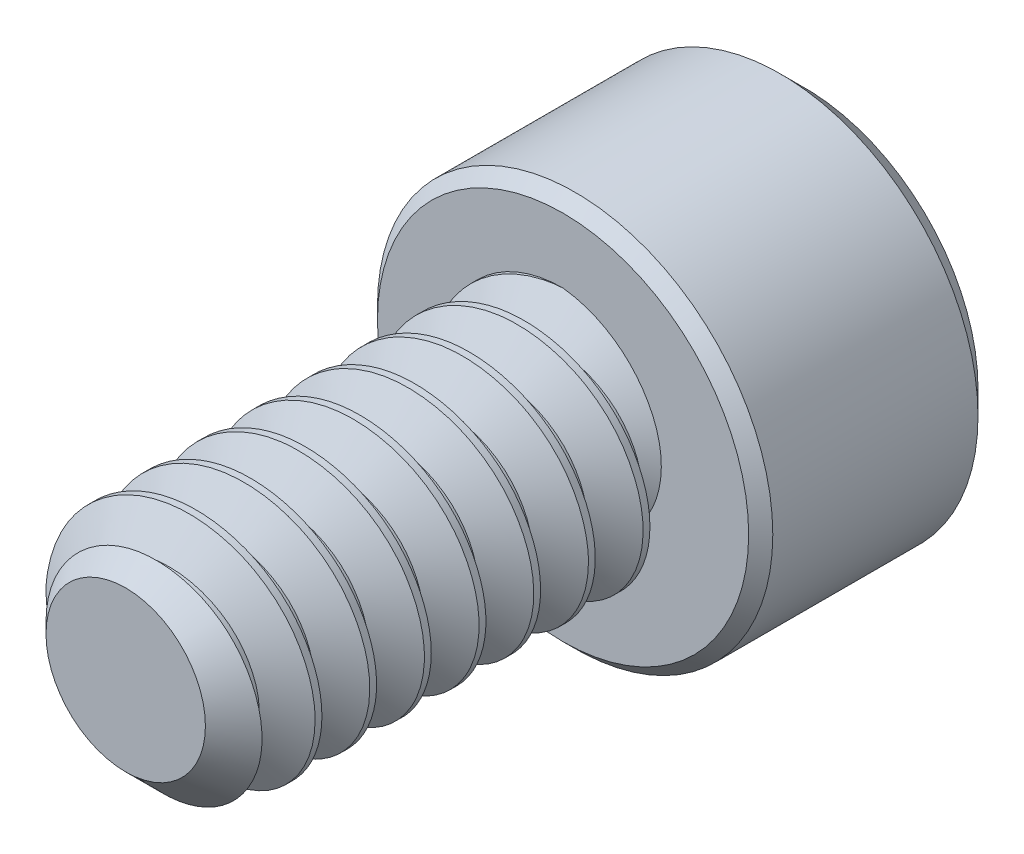
from build123d import *

# Parameters (mm, degrees)
SKETCH1_R          = 1.7526
EXTRUDE1_DEPTH     = 6.35
CHAMFER3_SIZE      = 0.5953125
CUT_SWEEP1_PITCH   = 0.79375
SKETCH6_R          = 2.8702
EXTRUDE2_DEPTH     = 3.5052
CUT_EXTRUDE1_DEPTH = 2.08359375
SKETCH8_R          = 1.603951217
CUT_EXTRUDE2_DEPTH = 0.35052
CUT_EXTRUDE2_DRAFT = -45
CHAMFER1_SIZE      = 0.35052
CHAMFER2_SIZE      = 0.17526


with BuildPart() as part:
    # Sketch1 → Extrude1 (new body)
    with BuildSketch(Plane.XY):
        Circle(SKETCH1_R)
    extrude(amount=-EXTRUDE1_DEPTH)

    # Chamfer3
    chamfer3_edges = [part.edges().sort_by_distance(p)[0] for p in [
        (-1.7526, 0, 0),
    ]]
    chamfer(chamfer3_edges, length=CHAMFER3_SIZE)

    # Cut-Sweep1: the profile of Sketch3 profile screwed along a right-hand helix of 9 turns, 6 arcs to a turn; built about Z, then put on its axis
    cut_sweep1_z = Axis((0, 0, 0), (0, 0, 1))
    cut_sweep1_corners = [(1.7529, 0, -0.694704455), (1.237044252, 0, -0.396875), (1.237044252, 0, -0.29765625), (1.7529, 0, 0.000173205)]
    with BuildLine(mode=Mode.PRIVATE) as cut_sweep1_profile:
        Line(cut_sweep1_corners[0], cut_sweep1_corners[1])
        Line(cut_sweep1_corners[1], cut_sweep1_corners[2])
        Line(cut_sweep1_corners[2], cut_sweep1_corners[3])
        Line(cut_sweep1_corners[3], cut_sweep1_corners[0])
    cut_sweep1_cap = Face(cut_sweep1_profile.wire())
    cut_sweep1_turn_angles = [0, 30, 60, 90, 120, 150, 180, 210, 240, 270, 300, 330, 360]
    cut_sweep1_turn_weights = [1, 0.8660254037844387, 1, 0.8660254037844387, 1, 0.8660254037844387, 1, 0.8660254037844387, 1, 0.8660254037844387, 1, 0.8660254037844387, 1]
    cut_sweep1_turn_rails = [Edge.make_bspline([Vector(p[0], p[1], 0).rotate(cut_sweep1_z, cut_sweep1_turn_angles[k]) / cut_sweep1_turn_weights[k] + Vector(0, 0, p[2] + CUT_SWEEP1_PITCH * cut_sweep1_turn_angles[k] / 360) for k in range(13)], [0, 0, 0, 1, 1, 2, 2, 3, 3, 4, 4, 5, 5, 6, 6, 6], 2, cut_sweep1_turn_weights) for p in cut_sweep1_corners]
    cut_sweep1_turn_sides = [Face.make_surface_from_curves(cut_sweep1_turn_rails[p[0]], cut_sweep1_turn_rails[p[1]]) for p in [(0, 1), (1, 2), (2, 3), (3, 0)]]
    cut_sweep1 = Plane(origin=(0, 0, 0), x_dir=(0, 1, 0), z_dir=(0, 0, -1)) * Solid(Shell([*[p.moved(Location((0, 0, CUT_SWEEP1_PITCH * i))) for i in range(9) for p in cut_sweep1_turn_sides], cut_sweep1_cap, cut_sweep1_cap.rotate(cut_sweep1_z, 3240).moved(Location((0, 0, CUT_SWEEP1_PITCH * 3240 / 360)))]))
    add(cut_sweep1, mode=Mode.SUBTRACT)

    # Sketch6 → Extrude2 (add)
    with BuildSketch(Plane(origin=(0, 0, -6.35), x_dir=(-1, 0, 0), z_dir=(0, 0, -1))):
        Circle(SKETCH6_R)
    extrude(amount=EXTRUDE2_DEPTH)

    # Sketch7 → Cut-Extrude1 (cut)
    with BuildSketch(Plane(origin=(0, 0, -9.8552), x_dir=(-1, 0, 0), z_dir=(0, 0, -1))):
        Polygon((0, 1.603951217), (-1.3890625, 0.801975608), (-1.3890625, -0.801975608), (0, -1.603951217), (1.3890625, -0.801975608), (1.3890625, 0.801975608), align=None)
    extrude(amount=-CUT_EXTRUDE1_DEPTH, mode=Mode.SUBTRACT)


with BuildPart() as cut_extrude2_tool:
    # Sketch8 → Cut-Extrude2 (with draft: the straight prism first)
    with BuildSketch(Plane(origin=(0, 0, -9.8552), x_dir=(-1, 0, 0), z_dir=(0, 0, -1))):
        Circle(SKETCH8_R)
    extrude(amount=-CUT_EXTRUDE2_DEPTH)
    # Cut-Extrude2: the draft: its side faces are tilted about the plane it starts from
    cut_extrude2_sides = [cut_extrude2_tool.faces().sort_by_distance(p)[0] for p in [
        (1.603951217, 0, -9.67994),
    ]]
    draft(cut_extrude2_sides, Plane(origin=(0, 0, -9.8552), x_dir=(-1, 0, 0), z_dir=(0, 0, -1)), CUT_EXTRUDE2_DRAFT)


with BuildPart() as part_1:
    add(part.part)

    # Cut-Extrude2: cut by cut_extrude2_tool
    add(cut_extrude2_tool.part, mode=Mode.SUBTRACT)

    # Chamfer1
    chamfer1_edges = [part_1.edges().sort_by_distance(p)[0] for p in [
        (2.8702, 0, -9.8552),
    ]]
    chamfer(chamfer1_edges, length=CHAMFER1_SIZE)

    # Chamfer2
    chamfer2_edges = [part_1.edges().sort_by_distance(p)[0] for p in [
        (2.8702, 0, -6.35),
    ]]
    chamfer(chamfer2_edges, length=CHAMFER2_SIZE)


solid = part_1.part
